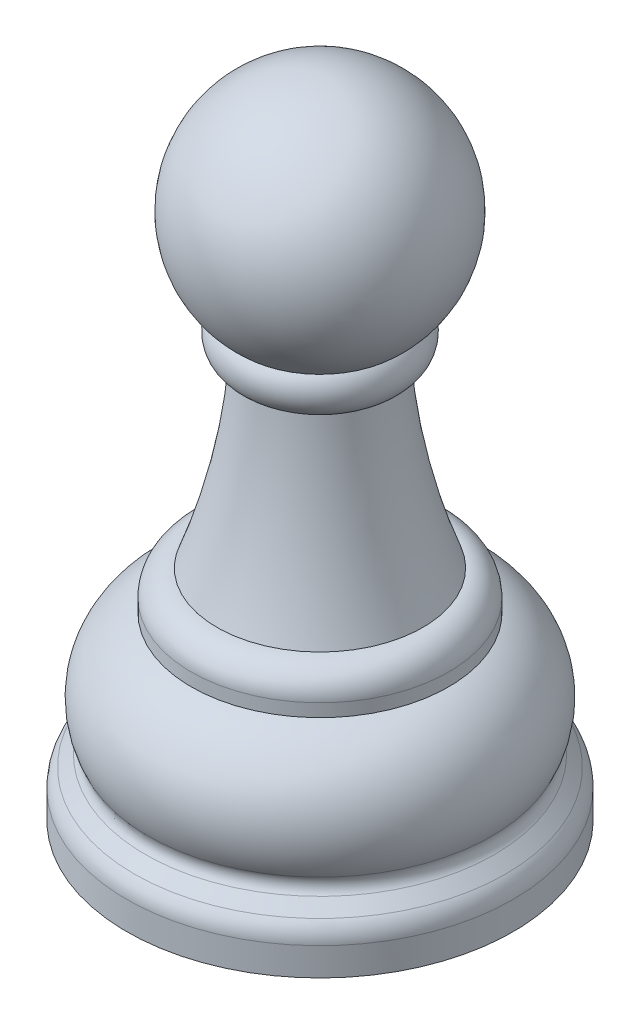
from build123d import *

# Parameters (mm, degrees)
FILLET1_R = 2
FILLET2_R = 1


with BuildPart() as part:
    # Sketch1 → Revolve1 (revolve)
    with BuildSketch(Plane.XY):
        with BuildLine():
            Line((0, 0), (0, -50))
            Line((0, -50), (13, -50))
            Line((13, -50), (15, -50))
            Line((15, -50), (15, -47))
            Line((15, -47), (13, -45))
            ThreePointArc((13, -45), (13.689044296, -39.782878162), (10, -36.03))
            Line((10, -36.03), (10, -35.03))
            ThreePointArc((10, -35.03), (9.414213562, -33.615786438), (8, -33.03))
            ThreePointArc((8, -33.03), (5.996281337, -26.137939714), (5, -19.03))
            ThreePointArc((5, -19.03), (6.412519214, -17.679913869), (6, -15.77))
            ThreePointArc((6, -15.77), (8.481867275, -5.799318094), (0, 0))
        make_face()
    revolve(axis=Axis((0, 0, 0), (0, -1, 0)))

    # Fillet1
    fillet1_edges = [part.edges().sort_by_distance(p)[0] for p in [
        (-15, -47, 0),
    ]]
    fillet(fillet1_edges, radius=FILLET1_R)

    # Fillet2
    fillet2_edges = [part.edges().sort_by_distance(p)[0] for p in [
        (-13, -45, 0),
    ]]
    fillet(fillet2_edges, radius=FILLET2_R)


solid = part.part
